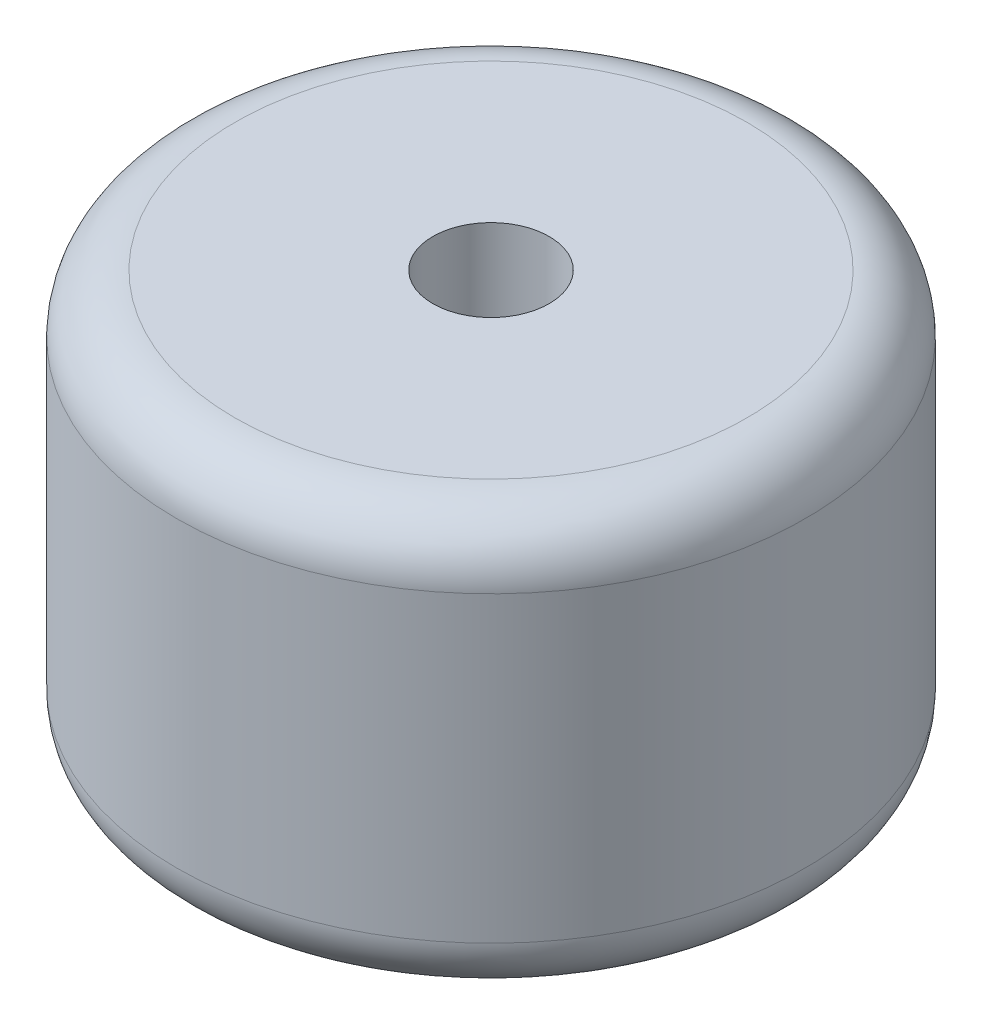
from build123d import *

# Parameters (mm, degrees)
CROQUIS1_R              = 27
CROQUIS1_R_2            = 5
SALIENTE_EXTRUIR1_DEPTH = 36
REDONDEO1_R             = 5


with BuildPart() as part:
    # Croquis1 → Saliente-Extruir1 (new body)
    with BuildSketch(Plane(origin=(0, 0, 0), x_dir=(1, 0, 0), z_dir=(0, 1, 0))):
        Circle(CROQUIS1_R)
        Circle(CROQUIS1_R_2, mode=Mode.SUBTRACT)
    extrude(amount=SALIENTE_EXTRUIR1_DEPTH)

    # Redondeo1
    redondeo1_edges = [part.edges().sort_by_distance(p)[0] for p in [
        (-27, 0, 0),
        (-27, 36, 0),
    ]]
    fillet(redondeo1_edges, radius=REDONDEO1_R)


solid = part.part
